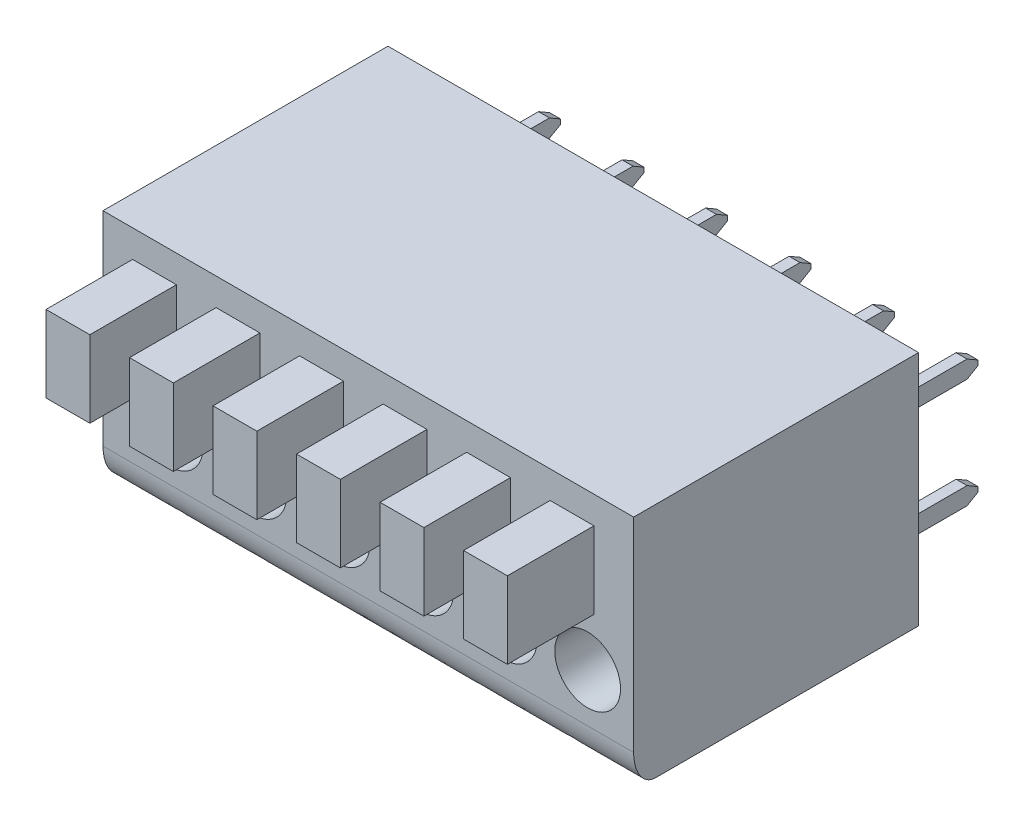
from build123d import *
from OCP.BRepFilletAPI import BRepFilletAPI_MakeChamfer

# Parameters (mm, degrees)
SKETCH_1_W                          = 24.21
SKETCH_1_H                          = 10.8
EXTRUDE_1_DEPTH                     = 13
FILLET_1_SIZE                       = 1
FILLET_1_SIZE_2                     = 1.5
SKETCH_2_W                          = 2
SKETCH_2_H                          = 3.5
EXTRUDE_2_DEPTH                     = 3.95
SKETCH_3_R                          = 1.5
CUT_EXTRUDE_1_DEPTH                 = 3.95
SKETCH_4_W                          = 0.5
SKETCH_4_H                          = 0.8
EXTRUDE_3_DEPTH                     = 3.5
CHAMFER_1_SIZE                      = 0.5
CHAMFER_1_SIZE2                     = 0.288675135
PATTERN_LINEAR_2_COUNT              = 6
PATTERN_LINEAR_2_PITCH              = 3.81
CHAMFER_1_OF_PATTERN_LINEAR_2_SIZE  = 0.5
CHAMFER_1_OF_PATTERN_LINEAR_2_SIZE2 = 0.288675135


with BuildPart() as part:
    # Эскиз1 → Бобышка-Вытянуть1 (new body)
    with BuildSketch(Plane.XY):
        Rectangle(SKETCH_1_W, SKETCH_1_H)
    extrude(amount=EXTRUDE_1_DEPTH)

    # Скругление1
    # an asymmetric fillet: 1.5, 1 mm, written as the material it takes off along each edge
    with BuildSketch(Plane(origin=(-15.855, -5.4, 13), x_dir=(0, 0, -1), z_dir=(1, 0, 0))) as fillet_1_piece_1:
        with BuildLine():
            Bezier((FILLET_1_SIZE, 0), (0, 0), (0, FILLET_1_SIZE_2), weights=[1, 0.707106781, 1])
            Line((0, FILLET_1_SIZE_2), (0, 0))
            Line((0, 0), (FILLET_1_SIZE, 0))
        make_face()
    extrude(amount=31.71, mode=Mode.SUBTRACT)

    # Эскиз2 → Бобышка-Вытянуть2 (add)
    with BuildSketch(Plane.XY.offset(13)):
        with Locations((9.295, 2.4)):
            Rectangle(SKETCH_2_W, SKETCH_2_H)
    extrude_2 = extrude(amount=EXTRUDE_2_DEPTH)

    # Эскиз3 → Вырез-Вытянуть1 (cut)
    with BuildSketch(Plane.XY.offset(13)):
        with Locations((10.005, -1.686021073)):
            Circle(SKETCH_3_R)
    cut_extrude_1 = extrude(amount=-CUT_EXTRUDE_1_DEPTH, mode=Mode.SUBTRACT)

    # Эскиз4 → Бобышка-Вытянуть3 (add)
    with BuildSketch(Plane(origin=(0, 0, 0), x_dir=(-1, 0, 0), z_dir=(0, 0, -1))):
        with Locations((-11.065, 2.85)):
            Rectangle(SKETCH_4_W, SKETCH_4_H)
        with Locations((-11.065, -2.15)):
            Rectangle(SKETCH_4_W, SKETCH_4_H)
    extrude_3 = extrude(amount=EXTRUDE_3_DEPTH)

    # Фаска1: one chamfer whose edges measure the first distance from different faces: ONE call of the kernel's chamfer builder (chamfer() names one face for all edges)
    chamfer_1_edges_1 = [part.edges().sort_by_distance(p)[0] for p in [
        (11.065, 3.25, -3.5),
    ]]
    chamfer_1_side_1 = [part.faces().sort_by_distance(p)[0] for p in [
        (11.065, 3.25, -1.75),
    ]]
    chamfer_1_edges_2 = [part.edges().sort_by_distance(p)[0] for p in [
        (11.065, 2.45, -3.5),
    ]]
    chamfer_1_side_2 = [part.faces().sort_by_distance(p)[0] for p in [
        (11.065, 2.45, -1.75),
    ]]
    chamfer_1_edges_3 = [part.edges().sort_by_distance(p)[0] for p in [
        (11.065, -2.55, -3.5),
    ]]
    chamfer_1_side_3 = [part.faces().sort_by_distance(p)[0] for p in [
        (11.065, -2.55, -1.75),
    ]]
    chamfer_1_edges_4 = [part.edges().sort_by_distance(p)[0] for p in [
        (11.065, -1.75, -3.5),
    ]]
    chamfer_1_side_4 = [part.faces().sort_by_distance(p)[0] for p in [
        (11.065, -1.75, -1.75),
    ]]
    chamfer_1 = BRepFilletAPI_MakeChamfer(part.part.solid().wrapped)
    for e in chamfer_1_edges_1:
        chamfer_1.Add(CHAMFER_1_SIZE, CHAMFER_1_SIZE2, e.wrapped, chamfer_1_side_1[0].wrapped)  # the first distance lies on this face
    for e in chamfer_1_edges_2:
        chamfer_1.Add(CHAMFER_1_SIZE, CHAMFER_1_SIZE2, e.wrapped, chamfer_1_side_2[0].wrapped)  # the first distance lies on this face
    for e in chamfer_1_edges_3:
        chamfer_1.Add(CHAMFER_1_SIZE, CHAMFER_1_SIZE2, e.wrapped, chamfer_1_side_3[0].wrapped)  # the first distance lies on this face
    for e in chamfer_1_edges_4:
        chamfer_1.Add(CHAMFER_1_SIZE, CHAMFER_1_SIZE2, e.wrapped, chamfer_1_side_4[0].wrapped)  # the first distance lies on this face
    add(Compound.cast(chamfer_1.Shape()), mode=Mode.REPLACE)

    # Линейный массив2: Бобышка-Вытянуть2, Вырез-Вытянуть1, Бобышка-Вытянуть3 ×6
    with Locations(*[(-i * PATTERN_LINEAR_2_PITCH, 0, 0) for i in range(1, PATTERN_LINEAR_2_COUNT)]):
        add(extrude_2)
        add(cut_extrude_1, mode=Mode.SUBTRACT)
        add(extrude_3)

    # Фаска1 of Линейный массив2: one chamfer whose edges measure the first distance from different faces: ONE call of the kernel's chamfer builder (chamfer() names one face for all edges)
    chamfer_1_of_pattern_linear_2_edges_1 = [part.edges().sort_by_distance(p)[0] for p in [
        (7.255, 3.25, -3.5),
    ]]
    chamfer_1_of_pattern_linear_2_side_1 = [part.faces().sort_by_distance(p)[0] for p in [
        (7.255, 3.25, -1.75),
    ]]
    chamfer_1_of_pattern_linear_2_edges_2 = [part.edges().sort_by_distance(p)[0] for p in [
        (7.255, 2.45, -3.5),
    ]]
    chamfer_1_of_pattern_linear_2_side_2 = [part.faces().sort_by_distance(p)[0] for p in [
        (7.255, 2.45, -1.75),
    ]]
    chamfer_1_of_pattern_linear_2_edges_3 = [part.edges().sort_by_distance(p)[0] for p in [
        (7.255, -2.55, -3.5),
    ]]
    chamfer_1_of_pattern_linear_2_side_3 = [part.faces().sort_by_distance(p)[0] for p in [
        (7.255, -2.55, -1.75),
    ]]
    chamfer_1_of_pattern_linear_2_edges_4 = [part.edges().sort_by_distance(p)[0] for p in [
        (7.255, -1.75, -3.5),
    ]]
    chamfer_1_of_pattern_linear_2_side_4 = [part.faces().sort_by_distance(p)[0] for p in [
        (7.255, -1.75, -1.75),
    ]]
    chamfer_1_of_pattern_linear_2_edges_5 = [part.edges().sort_by_distance(p)[0] for p in [
        (3.445, 3.25, -3.5),
    ]]
    chamfer_1_of_pattern_linear_2_side_5 = [part.faces().sort_by_distance(p)[0] for p in [
        (3.445, 3.25, -1.75),
    ]]
    chamfer_1_of_pattern_linear_2_edges_6 = [part.edges().sort_by_distance(p)[0] for p in [
        (3.445, 2.45, -3.5),
    ]]
    chamfer_1_of_pattern_linear_2_side_6 = [part.faces().sort_by_distance(p)[0] for p in [
        (3.445, 2.45, -1.75),
    ]]
    chamfer_1_of_pattern_linear_2_edges_7 = [part.edges().sort_by_distance(p)[0] for p in [
        (3.445, -2.55, -3.5),
    ]]
    chamfer_1_of_pattern_linear_2_side_7 = [part.faces().sort_by_distance(p)[0] for p in [
        (3.445, -2.55, -1.75),
    ]]
    chamfer_1_of_pattern_linear_2_edges_8 = [part.edges().sort_by_distance(p)[0] for p in [
        (3.445, -1.75, -3.5),
    ]]
    chamfer_1_of_pattern_linear_2_side_8 = [part.faces().sort_by_distance(p)[0] for p in [
        (3.445, -1.75, -1.75),
    ]]
    chamfer_1_of_pattern_linear_2_edges_9 = [part.edges().sort_by_distance(p)[0] for p in [
        (-0.365, 3.25, -3.5),
    ]]
    chamfer_1_of_pattern_linear_2_side_9 = [part.faces().sort_by_distance(p)[0] for p in [
        (-0.365, 3.25, -1.75),
    ]]
    chamfer_1_of_pattern_linear_2_edges_10 = [part.edges().sort_by_distance(p)[0] for p in [
        (-0.365, 2.45, -3.5),
    ]]
    chamfer_1_of_pattern_linear_2_side_10 = [part.faces().sort_by_distance(p)[0] for p in [
        (-0.365, 2.45, -1.75),
    ]]
    chamfer_1_of_pattern_linear_2_edges_11 = [part.edges().sort_by_distance(p)[0] for p in [
        (-0.365, -2.55, -3.5),
    ]]
    chamfer_1_of_pattern_linear_2_side_11 = [part.faces().sort_by_distance(p)[0] for p in [
        (-0.365, -2.55, -1.75),
    ]]
    chamfer_1_of_pattern_linear_2_edges_12 = [part.edges().sort_by_distance(p)[0] for p in [
        (-0.365, -1.75, -3.5),
    ]]
    chamfer_1_of_pattern_linear_2_side_12 = [part.faces().sort_by_distance(p)[0] for p in [
        (-0.365, -1.75, -1.75),
    ]]
    chamfer_1_of_pattern_linear_2_edges_13 = [part.edges().sort_by_distance(p)[0] for p in [
        (-4.175, 3.25, -3.5),
    ]]
    chamfer_1_of_pattern_linear_2_side_13 = [part.faces().sort_by_distance(p)[0] for p in [
        (-4.175, 3.25, -1.75),
    ]]
    chamfer_1_of_pattern_linear_2_edges_14 = [part.edges().sort_by_distance(p)[0] for p in [
        (-4.175, 2.45, -3.5),
    ]]
    chamfer_1_of_pattern_linear_2_side_14 = [part.faces().sort_by_distance(p)[0] for p in [
        (-4.175, 2.45, -1.75),
    ]]
    chamfer_1_of_pattern_linear_2_edges_15 = [part.edges().sort_by_distance(p)[0] for p in [
        (-4.175, -2.55, -3.5),
    ]]
    chamfer_1_of_pattern_linear_2_side_15 = [part.faces().sort_by_distance(p)[0] for p in [
        (-4.175, -2.55, -1.75),
    ]]
    chamfer_1_of_pattern_linear_2_edges_16 = [part.edges().sort_by_distance(p)[0] for p in [
        (-4.175, -1.75, -3.5),
    ]]
    chamfer_1_of_pattern_linear_2_side_16 = [part.faces().sort_by_distance(p)[0] for p in [
        (-4.175, -1.75, -1.75),
    ]]
    chamfer_1_of_pattern_linear_2_edges_17 = [part.edges().sort_by_distance(p)[0] for p in [
        (-7.985, 3.25, -3.5),
    ]]
    chamfer_1_of_pattern_linear_2_side_17 = [part.faces().sort_by_distance(p)[0] for p in [
        (-7.985, 3.25, -1.75),
    ]]
    chamfer_1_of_pattern_linear_2_edges_18 = [part.edges().sort_by_distance(p)[0] for p in [
        (-7.985, 2.45, -3.5),
    ]]
    chamfer_1_of_pattern_linear_2_side_18 = [part.faces().sort_by_distance(p)[0] for p in [
        (-7.985, 2.45, -1.75),
    ]]
    chamfer_1_of_pattern_linear_2_edges_19 = [part.edges().sort_by_distance(p)[0] for p in [
        (-7.985, -2.55, -3.5),
    ]]
    chamfer_1_of_pattern_linear_2_side_19 = [part.faces().sort_by_distance(p)[0] for p in [
        (-7.985, -2.55, -1.75),
    ]]
    chamfer_1_of_pattern_linear_2_edges_20 = [part.edges().sort_by_distance(p)[0] for p in [
        (-7.985, -1.75, -3.5),
    ]]
    chamfer_1_of_pattern_linear_2_side_20 = [part.faces().sort_by_distance(p)[0] for p in [
        (-7.985, -1.75, -1.75),
    ]]
    chamfer_1_of_pattern_linear_2 = BRepFilletAPI_MakeChamfer(part.part.solid().wrapped)
    for e in chamfer_1_of_pattern_linear_2_edges_1:
        chamfer_1_of_pattern_linear_2.Add(CHAMFER_1_OF_PATTERN_LINEAR_2_SIZE, CHAMFER_1_OF_PATTERN_LINEAR_2_SIZE2, e.wrapped, chamfer_1_of_pattern_linear_2_side_1[0].wrapped)  # the first distance lies on this face
    for e in chamfer_1_of_pattern_linear_2_edges_2:
        chamfer_1_of_pattern_linear_2.Add(CHAMFER_1_OF_PATTERN_LINEAR_2_SIZE, CHAMFER_1_OF_PATTERN_LINEAR_2_SIZE2, e.wrapped, chamfer_1_of_pattern_linear_2_side_2[0].wrapped)  # the first distance lies on this face
    for e in chamfer_1_of_pattern_linear_2_edges_3:
        chamfer_1_of_pattern_linear_2.Add(CHAMFER_1_OF_PATTERN_LINEAR_2_SIZE, CHAMFER_1_OF_PATTERN_LINEAR_2_SIZE2, e.wrapped, chamfer_1_of_pattern_linear_2_side_3[0].wrapped)  # the first distance lies on this face
    for e in chamfer_1_of_pattern_linear_2_edges_4:
        chamfer_1_of_pattern_linear_2.Add(CHAMFER_1_OF_PATTERN_LINEAR_2_SIZE, CHAMFER_1_OF_PATTERN_LINEAR_2_SIZE2, e.wrapped, chamfer_1_of_pattern_linear_2_side_4[0].wrapped)  # the first distance lies on this face
    for e in chamfer_1_of_pattern_linear_2_edges_5:
        chamfer_1_of_pattern_linear_2.Add(CHAMFER_1_OF_PATTERN_LINEAR_2_SIZE, CHAMFER_1_OF_PATTERN_LINEAR_2_SIZE2, e.wrapped, chamfer_1_of_pattern_linear_2_side_5[0].wrapped)  # the first distance lies on this face
    for e in chamfer_1_of_pattern_linear_2_edges_6:
        chamfer_1_of_pattern_linear_2.Add(CHAMFER_1_OF_PATTERN_LINEAR_2_SIZE, CHAMFER_1_OF_PATTERN_LINEAR_2_SIZE2, e.wrapped, chamfer_1_of_pattern_linear_2_side_6[0].wrapped)  # the first distance lies on this face
    for e in chamfer_1_of_pattern_linear_2_edges_7:
        chamfer_1_of_pattern_linear_2.Add(CHAMFER_1_OF_PATTERN_LINEAR_2_SIZE, CHAMFER_1_OF_PATTERN_LINEAR_2_SIZE2, e.wrapped, chamfer_1_of_pattern_linear_2_side_7[0].wrapped)  # the first distance lies on this face
    for e in chamfer_1_of_pattern_linear_2_edges_8:
        chamfer_1_of_pattern_linear_2.Add(CHAMFER_1_OF_PATTERN_LINEAR_2_SIZE, CHAMFER_1_OF_PATTERN_LINEAR_2_SIZE2, e.wrapped, chamfer_1_of_pattern_linear_2_side_8[0].wrapped)  # the first distance lies on this face
    for e in chamfer_1_of_pattern_linear_2_edges_9:
        chamfer_1_of_pattern_linear_2.Add(CHAMFER_1_OF_PATTERN_LINEAR_2_SIZE, CHAMFER_1_OF_PATTERN_LINEAR_2_SIZE2, e.wrapped, chamfer_1_of_pattern_linear_2_side_9[0].wrapped)  # the first distance lies on this face
    for e in chamfer_1_of_pattern_linear_2_edges_10:
        chamfer_1_of_pattern_linear_2.Add(CHAMFER_1_OF_PATTERN_LINEAR_2_SIZE, CHAMFER_1_OF_PATTERN_LINEAR_2_SIZE2, e.wrapped, chamfer_1_of_pattern_linear_2_side_10[0].wrapped)  # the first distance lies on this face
    for e in chamfer_1_of_pattern_linear_2_edges_11:
        chamfer_1_of_pattern_linear_2.Add(CHAMFER_1_OF_PATTERN_LINEAR_2_SIZE, CHAMFER_1_OF_PATTERN_LINEAR_2_SIZE2, e.wrapped, chamfer_1_of_pattern_linear_2_side_11[0].wrapped)  # the first distance lies on this face
    for e in chamfer_1_of_pattern_linear_2_edges_12:
        chamfer_1_of_pattern_linear_2.Add(CHAMFER_1_OF_PATTERN_LINEAR_2_SIZE, CHAMFER_1_OF_PATTERN_LINEAR_2_SIZE2, e.wrapped, chamfer_1_of_pattern_linear_2_side_12[0].wrapped)  # the first distance lies on this face
    for e in chamfer_1_of_pattern_linear_2_edges_13:
        chamfer_1_of_pattern_linear_2.Add(CHAMFER_1_OF_PATTERN_LINEAR_2_SIZE, CHAMFER_1_OF_PATTERN_LINEAR_2_SIZE2, e.wrapped, chamfer_1_of_pattern_linear_2_side_13[0].wrapped)  # the first distance lies on this face
    for e in chamfer_1_of_pattern_linear_2_edges_14:
        chamfer_1_of_pattern_linear_2.Add(CHAMFER_1_OF_PATTERN_LINEAR_2_SIZE, CHAMFER_1_OF_PATTERN_LINEAR_2_SIZE2, e.wrapped, chamfer_1_of_pattern_linear_2_side_14[0].wrapped)  # the first distance lies on this face
    for e in chamfer_1_of_pattern_linear_2_edges_15:
        chamfer_1_of_pattern_linear_2.Add(CHAMFER_1_OF_PATTERN_LINEAR_2_SIZE, CHAMFER_1_OF_PATTERN_LINEAR_2_SIZE2, e.wrapped, chamfer_1_of_pattern_linear_2_side_15[0].wrapped)  # the first distance lies on this face
    for e in chamfer_1_of_pattern_linear_2_edges_16:
        chamfer_1_of_pattern_linear_2.Add(CHAMFER_1_OF_PATTERN_LINEAR_2_SIZE, CHAMFER_1_OF_PATTERN_LINEAR_2_SIZE2, e.wrapped, chamfer_1_of_pattern_linear_2_side_16[0].wrapped)  # the first distance lies on this face
    for e in chamfer_1_of_pattern_linear_2_edges_17:
        chamfer_1_of_pattern_linear_2.Add(CHAMFER_1_OF_PATTERN_LINEAR_2_SIZE, CHAMFER_1_OF_PATTERN_LINEAR_2_SIZE2, e.wrapped, chamfer_1_of_pattern_linear_2_side_17[0].wrapped)  # the first distance lies on this face
    for e in chamfer_1_of_pattern_linear_2_edges_18:
        chamfer_1_of_pattern_linear_2.Add(CHAMFER_1_OF_PATTERN_LINEAR_2_SIZE, CHAMFER_1_OF_PATTERN_LINEAR_2_SIZE2, e.wrapped, chamfer_1_of_pattern_linear_2_side_18[0].wrapped)  # the first distance lies on this face
    for e in chamfer_1_of_pattern_linear_2_edges_19:
        chamfer_1_of_pattern_linear_2.Add(CHAMFER_1_OF_PATTERN_LINEAR_2_SIZE, CHAMFER_1_OF_PATTERN_LINEAR_2_SIZE2, e.wrapped, chamfer_1_of_pattern_linear_2_side_19[0].wrapped)  # the first distance lies on this face
    for e in chamfer_1_of_pattern_linear_2_edges_20:
        chamfer_1_of_pattern_linear_2.Add(CHAMFER_1_OF_PATTERN_LINEAR_2_SIZE, CHAMFER_1_OF_PATTERN_LINEAR_2_SIZE2, e.wrapped, chamfer_1_of_pattern_linear_2_side_20[0].wrapped)  # the first distance lies on this face
    add(Compound.cast(chamfer_1_of_pattern_linear_2.Shape()), mode=Mode.REPLACE)


solid = part.part
